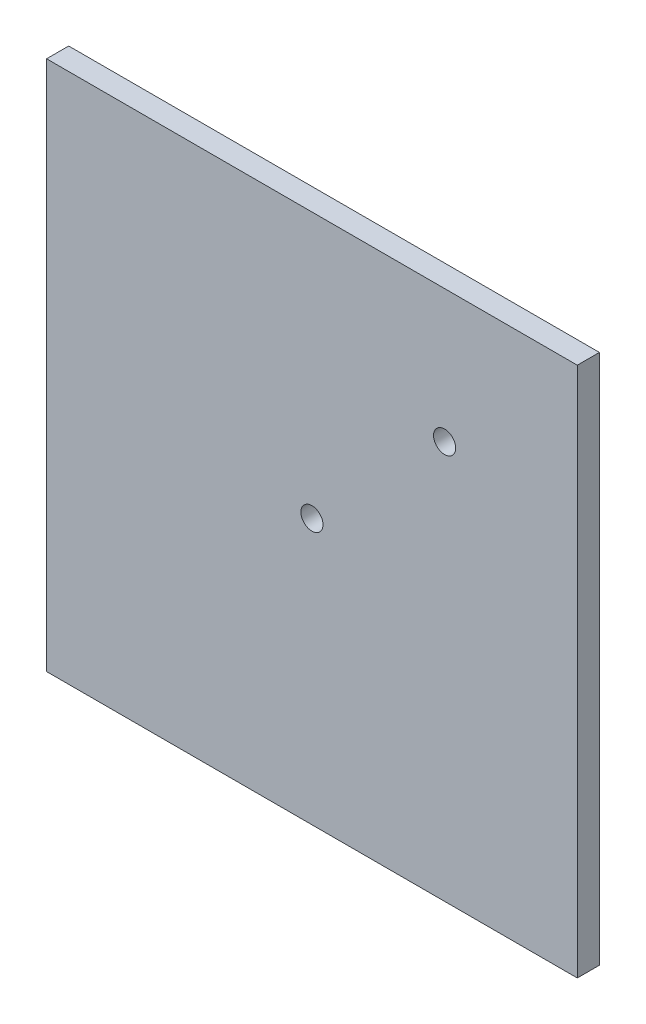
from build123d import *

# Parameters (mm, degrees)
SKETCH1_W           = 152.4
SKETCH1_H           = 152.4
SKETCH1_R           = 3.175
BOSS_EXTRUDE1_DEPTH = 6.35


with BuildPart() as part:
    # Sketch1 → Boss-Extrude1 (new body)
    with BuildSketch(Plane.XY):
        with Locations((76.2, 76.2)):
            Rectangle(SKETCH1_W, SKETCH1_H)
        with Locations((76.2, 76.2)):
            Circle(SKETCH1_R, mode=Mode.SUBTRACT)
        with Locations((114.3, 114.3)):
            Circle(SKETCH1_R, mode=Mode.SUBTRACT)
    extrude(amount=BOSS_EXTRUDE1_DEPTH)


solid = part.part
